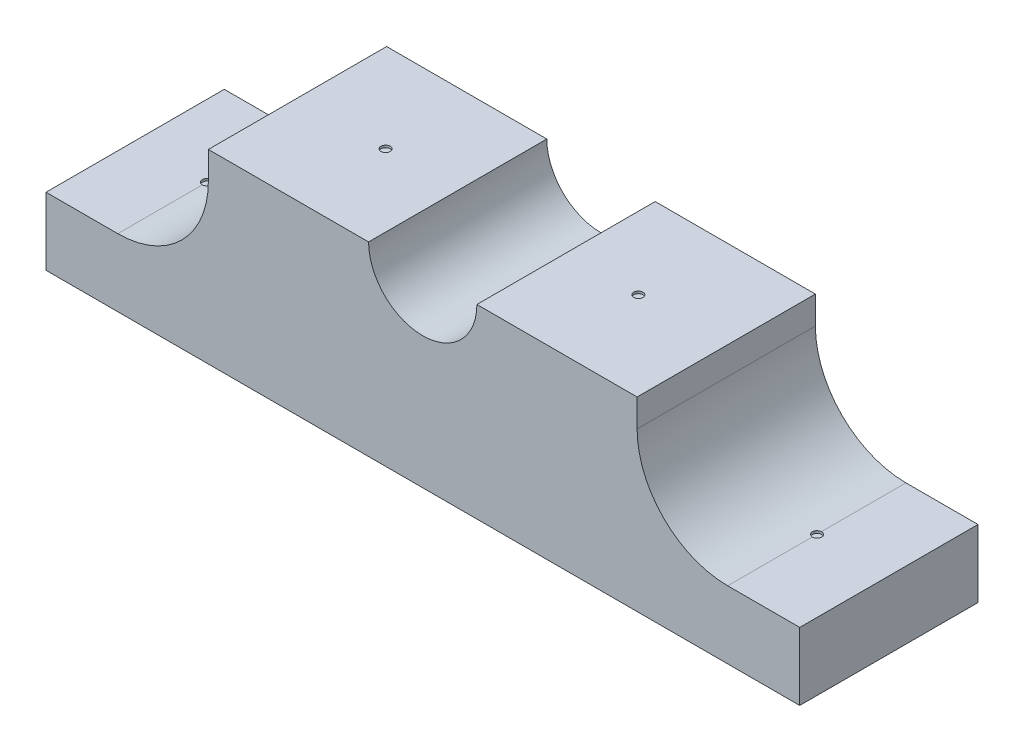
from build123d import *

# Parameters (mm, degrees)
SKETCH2_W               = 41.746000074
SKETCH2_H               = 9.873000066
BOSS_EXTRUDE1_DEPTH     = 3.746000128
SKETCH3_W               = 23.746000006
SKETCH3_H               = 9.873000066
BOSS_EXTRUDE2_DEPTH     = 6.548499984
FILLET1_R               = 5.0165
SKETCH4_R               = 2.99974
CUT_EXTRUDE1_DEPTH      = 26.281119307
CUT_EXTRUDE2_DEPTH      = 23.426190384
CUT_EXTRUDE2_DEPTH_BACK = 0.127
SKETCH6_R               = 0.254
SKETCH7_R               = 0.254
CUT_EXTRUDE3_DEPTH      = 0.127


with BuildPart() as part:
    # Sketch2 → Boss-Extrude1 (new body)
    with BuildSketch(Plane(origin=(0, 0, 0), x_dir=(1, 0, 0), z_dir=(0, 1, 0))):
        Rectangle(SKETCH2_W, SKETCH2_H)
    extrude(amount=BOSS_EXTRUDE1_DEPTH)

    # Sketch3 → Boss-Extrude2 (add)
    with BuildSketch(Plane(origin=(0, 3.746000128, 0), x_dir=(1, 0, 0), z_dir=(0, 1, 0))):
        with Locations((-0.00733485, 0)):
            Rectangle(SKETCH3_W, SKETCH3_H)
    extrude(amount=BOSS_EXTRUDE2_DEPTH)

    # Fillet1
    fillet1_edges = [part.edges().sort_by_distance(p)[0] for p in [
        (11.865665153, 3.746000128, 0),
        (-11.880334853, 3.746000128, 0),
    ]]
    fillet(fillet1_edges, radius=FILLET1_R)

    # Sketch4 → Cut-Extrude1 (cut, through all)
    with BuildSketch(Plane.XY.offset(4.936500033)):
        with Locations((-0.00733485, 10.294500112)):
            Circle(SKETCH4_R)
    extrude(amount=-CUT_EXTRUDE1_DEPTH, mode=Mode.SUBTRACT)

    # Sketch6 → Cut-Extrude2 (cut, two sides: drawn at the far end of the back side and taken through both)
    with BuildSketch(Plane(origin=(0, 3.746000128, 0), x_dir=(1, 0, 0), z_dir=(0, 1, 0)).offset(-CUT_EXTRUDE2_DEPTH_BACK)):
        with Locations((-16.896834853, 0)):
            Circle(SKETCH6_R)
        with Locations((16.896834853, 0)):
            Circle(SKETCH6_R)
    extrude(amount=CUT_EXTRUDE2_DEPTH + CUT_EXTRUDE2_DEPTH_BACK, mode=Mode.SUBTRACT)

    # Sketch7 → Cut-Extrude3 (cut)
    with BuildSketch(Plane(origin=(0, 10.294500112, 0), x_dir=(1, 0, 0), z_dir=(0, 1, 0))):
        with Locations((-6.99999997, 0)):
            Circle(SKETCH7_R)
        with Locations((6.99999997, 0)):
            Circle(SKETCH7_R)
    extrude(amount=-CUT_EXTRUDE3_DEPTH, mode=Mode.SUBTRACT)


solid = part.part
